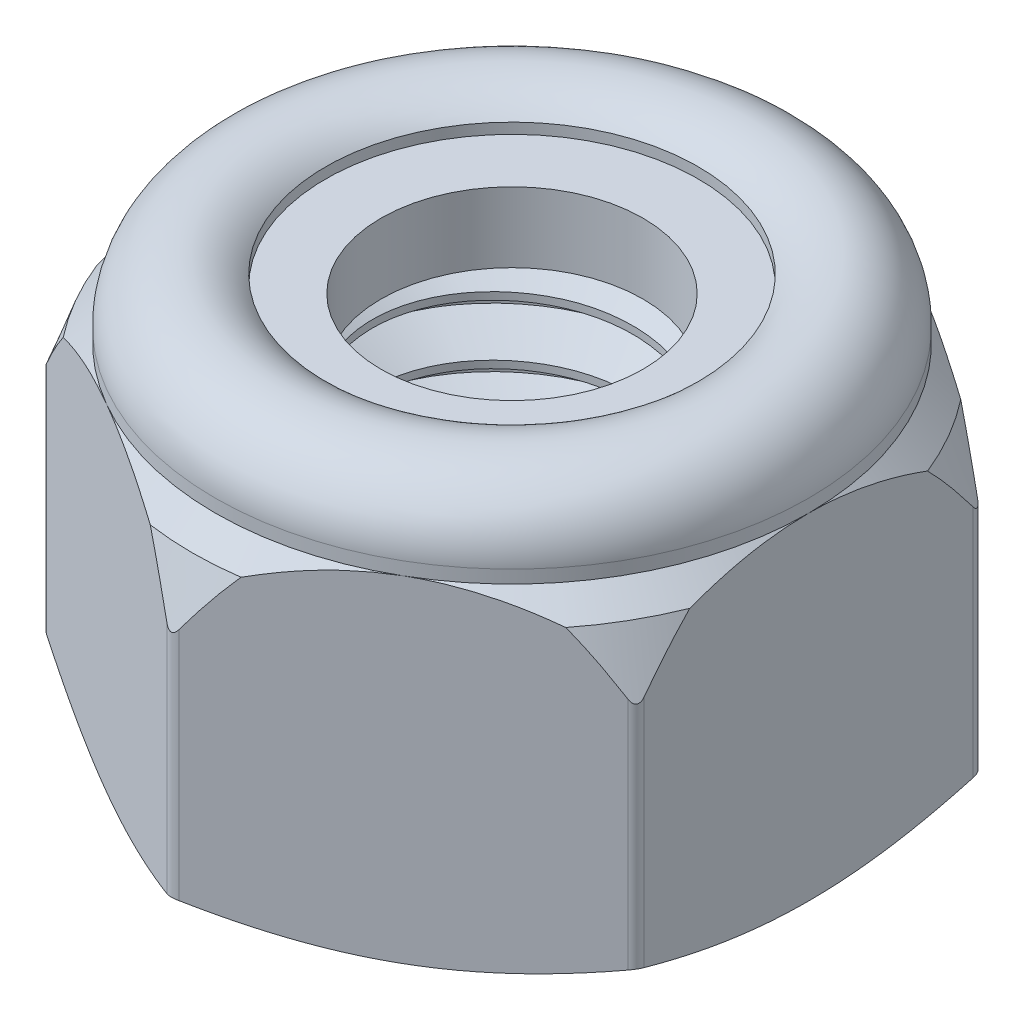
from build123d import *

# Parameters (mm, degrees)
BOSS_EXTRUDE1_DEPTH      = 2.5
BOSS_EXTRUDE1_DEPTH_BACK = 2.5
SKETCH2_R                = 1.545336663
FILLET1_R                = 0.14
SKETCH4_W                = 1.191319822
SKETCH4_H                = 0.826421861
SKETCH6_W                = 2
SKETCH6_H                = 4.083987782
CUT_SWEEP1_PITCH         = 0.7
SKETCH10_R               = 1.945336663
BOSS_EXTRUDE2_DEPTH      = 3.75


with BuildPart() as part:
    # Sketch2 → Boss-Extrude1 (new, two sides: drawn at the far end of the back side and taken through both)
    with BuildSketch(Plane(origin=(0, 0, 0), x_dir=(1, 0, 0), z_dir=(0, 1, 0)).offset(-BOSS_EXTRUDE1_DEPTH_BACK)):
        Polygon((0, 4.041451884), (-3.5, 2.020725942), (-3.5, -2.020725942), (0, -4.041451884), (3.5, -2.020725942), (3.5, 2.020725942), align=None)
        with Locations(Location((0, 0, 0), (0, 0, 270))):
            Circle(SKETCH2_R, mode=Mode.SUBTRACT)
    extrude(amount=BOSS_EXTRUDE1_DEPTH + BOSS_EXTRUDE1_DEPTH_BACK)

    # Sketch3 → Cut-Revolve2 (revolve, cut)
    with BuildSketch(Plane(origin=(0, 0, 0), x_dir=(0, 0, -1), z_dir=(1, 0, 0)), mode=Mode.PRIVATE) as cut_revolve2_sk:
        with BuildLine():
            Line((4.041451884, 1.583987782), (4.041451884, 3.416012218))
            Line((4.041451884, 3.416012218), (1.545336663, 3.416012218))
            Line((1.545336663, 3.416012218), (1.545336663, 1.25))
            Line((1.545336663, 1.25), (2.196891109, 1.25))
            Line((2.196891109, 1.25), (2.736656485, 1.25))
            Line((2.736656485, 1.25), (2.736656485, 2.151421861))
            Line((2.736656485, 2.151421861), (2.196891109, 2.151421861))
            Line((2.196891109, 2.151421861), (2.196891109, 2.276421861))
            ThreePointArc((2.196891109, 2.276421861), (3.028775401, 2.441893935), (3.5, 1.736656485))
            Line((3.5, 1.736656485), (3.5, 1.583987782))
            Line((3.5, 1.583987782), (4.041451884, 1.042535897))
            Line((4.041451884, 1.042535897), (4.041451884, 1.583987782))
        make_face()
        Polygon((3.29, -2.5), (4.041451884, -2.066149052), (4.041451884, -2.5), align=None)
        Polygon((1.545336663, -2.5), (1.545336663, -2.1), (1.945336663, -2.5), align=None)
    revolve(cut_revolve2_sk.sketch.rotate(Axis((0, -2.5, 0), (0, 1, 0)), 270), axis=Axis((0, -2.5, 0), (0, 1, 0)), mode=Mode.SUBTRACT)

    # Sketch11 → Cut-Revolve3 (revolve, cut)
    with BuildSketch(Plane(origin=(0, 0, 0), x_dir=(0, 0, -1), z_dir=(1, 0, 0)), mode=Mode.PRIVATE) as cut_revolve3_sk:
        Polygon((4.041451884, 0.569448427), (4.041451884, 1.313261839), (3.770725942, 1.313261839), align=None)
    revolve(cut_revolve3_sk.sketch.rotate(Axis((0, -2.5, 0), (0, 1, 0)), 270), axis=Axis((0, -2.5, 0), (0, 1, 0)), mode=Mode.SUBTRACT)

    # Fillet1
    fillet1_edges = [part.edges().sort_by_distance(p)[0] for p in [
        (-3.5, -0.748350313, -2.020725942),
        (0, -0.748350313, -4.041451884),
        (-3.5, -0.748350313, 2.020725942),
        (3.5, -0.748350313, -2.020725942),
        (3.5, -0.748350313, 2.020725942),
        (0, -0.748350313, 4.041451884),
    ]]
    fillet(fillet1_edges, radius=FILLET1_R)

    # Sketch10 → Boss-Extrude2 (add)
    with BuildSketch(Plane.XZ.offset(2.5)):
        Circle(SKETCH10_R)
    extrude(amount=-BOSS_EXTRUDE2_DEPTH)


with BuildPart() as body_2:
    # Sketch4 → Revolve1 (revolve)
    with BuildSketch(Plane(origin=(0, 0, 0), x_dir=(0, 0, -1), z_dir=(1, 0, 0)), mode=Mode.PRIVATE) as revolve1_sk:
        with Locations((2.140996574, 1.663210931)):
            Rectangle(SKETCH4_W, SKETCH4_H)
    revolve(revolve1_sk.sketch.rotate(Axis((0, -2.5, 0), (0, 1, 0)), 270), axis=Axis((0, -2.5, 0), (0, 1, 0)))


with BuildPart() as body_3:
    # Sketch6 → Revolve2 (revolve)
    with BuildSketch(Plane.XY, mode=Mode.PRIVATE) as revolve2_sk:
        with Locations((1, -0.458006109)):
            Rectangle(SKETCH6_W, SKETCH6_H)
    revolve(revolve2_sk.sketch.rotate(Axis((0, -2.5, 0), (0, 1, 0)), 90), axis=Axis((0, -2.5, 0), (0, 1, 0)))

    # Cut-Sweep1: the profile of Sketch8 profile screwed along a right-hand helix of 7.142857 turns, 6 arcs to a turn; built about Z, then put on its axis
    cut_sweep1_z = Axis((0, 0, 0), (0, 0, 1))
    cut_sweep1_corners = [(1.545036663, 0, -0.262673205), (1.545036663, 0, -0.349826795), (2.037888611, 0, -0.634375), (2.075777223, 0, 0.04375)]
    with BuildLine(mode=Mode.PRIVATE) as cut_sweep1_profile:
        Line(cut_sweep1_corners[0], cut_sweep1_corners[1])
        Line(cut_sweep1_corners[1], cut_sweep1_corners[2])
        Line(cut_sweep1_corners[2], cut_sweep1_corners[3])
        Line(cut_sweep1_corners[3], cut_sweep1_corners[0])
    cut_sweep1_cap = Face(cut_sweep1_profile.wire())
    cut_sweep1_turn_angles = [0, 30, 60, 90, 120, 150, 180, 210, 240, 270, 300, 330, 360]
    cut_sweep1_turn_weights = [1, 0.8660254037844387, 1, 0.8660254037844387, 1, 0.8660254037844387, 1, 0.8660254037844387, 1, 0.8660254037844387, 1, 0.8660254037844387, 1]
    cut_sweep1_turn_rails = [Edge.make_bspline([Vector(p[0], p[1], 0).rotate(cut_sweep1_z, cut_sweep1_turn_angles[k]) / cut_sweep1_turn_weights[k] + Vector(0, 0, p[2] + CUT_SWEEP1_PITCH * cut_sweep1_turn_angles[k] / 360) for k in range(13)], [0, 0, 0, 1, 1, 2, 2, 3, 3, 4, 4, 5, 5, 6, 6, 6], 2, cut_sweep1_turn_weights) for p in cut_sweep1_corners]
    cut_sweep1_turn_sides = [Face.make_surface_from_curves(cut_sweep1_turn_rails[p[0]], cut_sweep1_turn_rails[p[1]]) for p in [(0, 1), (1, 2), (2, 3), (3, 0)]]
    cut_sweep1_last_angles = [2520, 2545.714285714, 2571.428571429]
    cut_sweep1_last_weights = [1, 0.9009688679024014, 1]
    cut_sweep1_last_rails = [Edge.make_bspline([Vector(p[0], p[1], 0).rotate(cut_sweep1_z, cut_sweep1_last_angles[k]) / cut_sweep1_last_weights[k] + Vector(0, 0, p[2] + CUT_SWEEP1_PITCH * cut_sweep1_last_angles[k] / 360) for k in range(3)], [0, 0, 0, 1, 1, 1], 2, cut_sweep1_last_weights) for p in cut_sweep1_corners]
    cut_sweep1_last_sides = [Face.make_surface_from_curves(cut_sweep1_last_rails[p[0]], cut_sweep1_last_rails[p[1]]) for p in [(0, 1), (1, 2), (2, 3), (3, 0)]]
    cut_sweep1 = Plane(origin=(0, -2.5, 0), x_dir=(1, 0, 0), z_dir=(0, 1, 0)) * Solid(Shell([*[p.moved(Location((0, 0, CUT_SWEEP1_PITCH * i))) for i in range(7) for p in cut_sweep1_turn_sides], *cut_sweep1_last_sides, cut_sweep1_cap, cut_sweep1_cap.rotate(cut_sweep1_z, 2571.428571429).moved(Location((0, 0, CUT_SWEEP1_PITCH * 2571.428571429 / 360)))]))
    add(cut_sweep1, mode=Mode.SUBTRACT)

    # Sketch9 → Revolve3 (revolve)
    with BuildSketch(Plane.XY, mode=Mode.PRIVATE) as revolve3_sk:
        Polygon((0, -0.5), (0, -2.5), (2, -2.5), (2.4, -2.5), (0, -0.1), align=None)
    revolve(revolve3_sk.sketch.rotate(Axis((0, -0.5, 0), (0, -1, 0)), 100.038754431), axis=Axis((0, -0.5, 0), (0, -1, 0)))


with BuildPart() as part_1:
    add(part.part)

    # Combine1: cut body 3
    add(body_3.part, mode=Mode.SUBTRACT)


solid = Compound([body_2.part, part_1.part])
